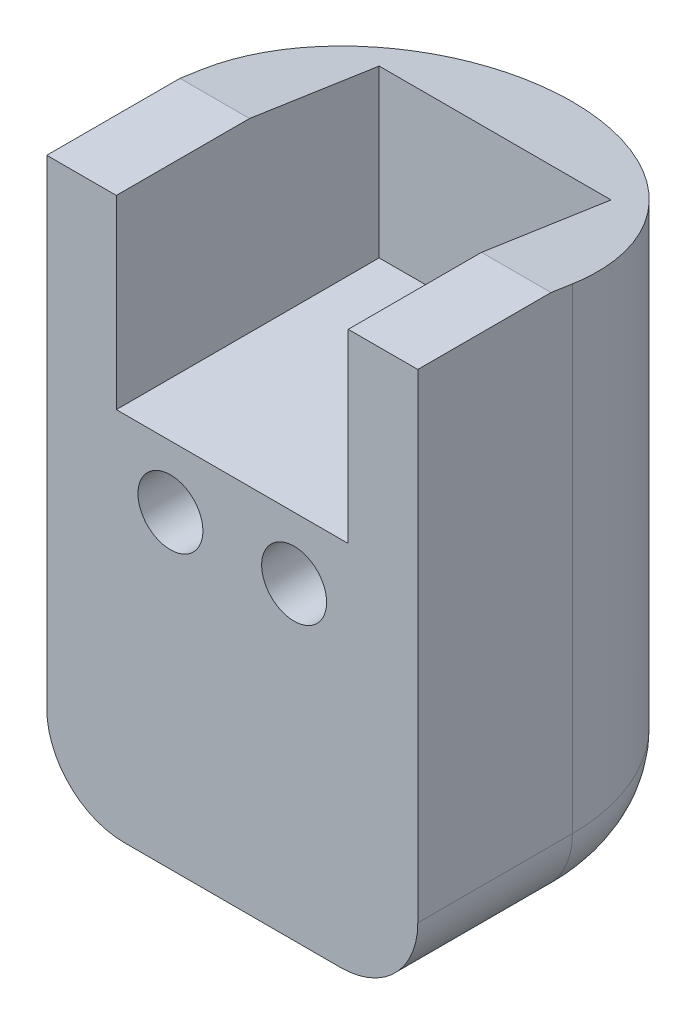
from build123d import *

# Parameters (mm, degrees)
EXTRUDE_1_DEPTH     = 10
SKETCH_2_W          = 24
SKETCH_2_H          = 25
EXTRUDE_2_DEPTH     = 12
EXTRUDE_3_DEPTH     = 11
CUT_EXTRUDE_1_DEPTH = 15
SKETCH_5_W          = 15
SKETCH_5_H          = 17
CUT_EXTRUDE_2_DEPTH = 1
FILLET_2_R          = 12
FILLET_3_R          = 5
SKETCH_6_R          = 2.1
CUT_EXTRUDE_3_DEPTH = 30
CUT_EXTRUDE_START   = -15
SKETCH_7_R          = 3.5
CUT_EXTRUDE_4_DEPTH = 10


with BuildPart() as part:
    # 草图1 → 凸台-拉伸1 (new body)
    with BuildSketch(Plane.XY):
        Polygon((-7.5, 0), (-12, 0), (-12, -36), (12, -36), (12, 0), (7.5, 0), (7.5, -11), (-7.5, -11), align=None)
    extrude(amount=EXTRUDE_1_DEPTH)

    # 草图2 → 凸台-拉伸2 (add)
    with BuildSketch(Plane(origin=(0, 0, 0), x_dir=(-1, 0, 0), z_dir=(0, 0, -1))):
        with Locations((0, -23.5)):
            Rectangle(SKETCH_2_W, SKETCH_2_H)
    extrude(amount=EXTRUDE_2_DEPTH)

    # 草图3 → 凸台-拉伸3 (add)
    with BuildSketch(Plane(origin=(0, -11, 0), x_dir=(1, 0, 0), z_dir=(0, 1, 0))):
        Polygon((-7.5, 0), (-7.5, 7), (7.5, 7), (7.5, 0), (12, 0), (12, 12), (-12, 12), (-12, 0), align=None)
    extrude(amount=EXTRUDE_3_DEPTH)

    # 草图4 → 切除-拉伸1 (cut, symmetric)
    with BuildSketch(Plane(origin=(0, 0, 0), x_dir=(0, 0, -1), z_dir=(1, 0, 0))):
        Polygon((-1.382312477, 0), (12, -2), (12, 0), align=None)
    extrude(amount=CUT_EXTRUDE_1_DEPTH, both=True, mode=Mode.SUBTRACT)

    # 草图5 → 切除-拉伸2 (cut)
    with BuildSketch(Plane(origin=(0, -11, 0), x_dir=(1, 0, 0), z_dir=(0, 1, 0))):
        with Locations((0, -1.5)):
            Rectangle(SKETCH_5_W, SKETCH_5_H)
    extrude(amount=-CUT_EXTRUDE_2_DEPTH, mode=Mode.SUBTRACT)

    # 圆角2
    fillet_2_edges = [part.edges().sort_by_distance(p)[0] for p in [
        (12, -19, -12),
        (-12, -19, -12),
    ]]
    fillet(fillet_2_edges, radius=FILLET_2_R - 0.0001)  # a hair under: the kernel refuses the full size

    # 圆角3
    fillet_3_edges = [part.edges().sort_by_distance(p)[0] for p in [
        (8.485310664, -36, -8.485310664),
        (-8.485310664, -36, -8.485310664),
        (12, -36, 4.99995),
        (-12, -36, 4.99995),
    ]]
    fillet(fillet_3_edges, radius=FILLET_3_R)

    # 草图6 → 切除-拉伸3 (cut)
    with BuildSketch(Plane.XY.offset(10)):
        with Locations((4, -16)):
            Circle(SKETCH_6_R)
        with Locations((-4, -16)):
            Circle(SKETCH_6_R)
    extrude(amount=-CUT_EXTRUDE_3_DEPTH, mode=Mode.SUBTRACT)

    # 草图7 → 切除-拉伸4 (cut)
    with BuildSketch(Plane.XY.offset(10).offset(CUT_EXTRUDE_START)):
        with Locations((4, -16)):
            Circle(SKETCH_7_R)
        with Locations((-4, -16)):
            Circle(SKETCH_7_R)
    extrude(amount=-CUT_EXTRUDE_4_DEPTH, mode=Mode.SUBTRACT)


solid = part.part
